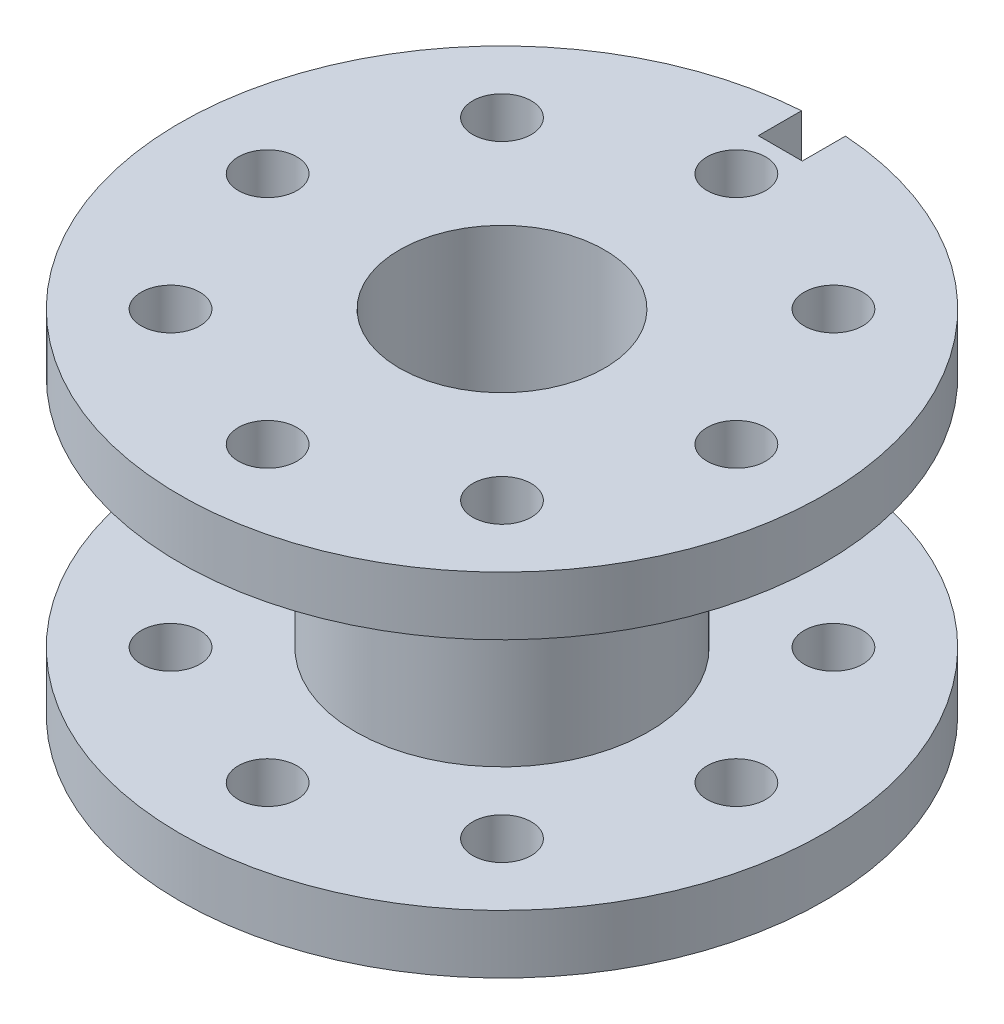
from build123d import *

# Parameters (mm, degrees)
SKETCH1_R           = 11
SKETCH1_R_2         = 1
BOSS_EXTRUDE1_DEPTH = 12
SKETCH2_R           = 3.5
CUT_EXTRUDE1_DEPTH  = 20.646882704
CUT_EXTRUDE2_START  = -8
SKETCH3_R           = 11
SKETCH3_R_2         = 5
CUT_EXTRUDE2_DEPTH  = 8
SKETCH4_W           = 1.5
SKETCH4_H           = 3
CUT_EXTRUDE3_DEPTH  = 4


with BuildPart() as part:
    # Sketch1 → Boss-Extrude1 (new body)
    with BuildSketch(Plane(origin=(0, 0, 0), x_dir=(1, 0, 0), z_dir=(0, 1, 0))):
        Circle(SKETCH1_R)
        with Locations((0, 8)):
            Circle(SKETCH1_R_2, mode=Mode.SUBTRACT)
        with Locations((5.656854249, 5.656854249)):
            Circle(SKETCH1_R_2, mode=Mode.SUBTRACT)
        with Locations((8, 0)):
            Circle(SKETCH1_R_2, mode=Mode.SUBTRACT)
        with Locations((5.656854249, -5.656854249)):
            Circle(SKETCH1_R_2, mode=Mode.SUBTRACT)
        with Locations((0, -8)):
            Circle(SKETCH1_R_2, mode=Mode.SUBTRACT)
        with Locations((-5.656854249, -5.656854249)):
            Circle(SKETCH1_R_2, mode=Mode.SUBTRACT)
        with Locations((-8, 0)):
            Circle(SKETCH1_R_2, mode=Mode.SUBTRACT)
        with Locations((-5.656854249, 5.656854249)):
            Circle(SKETCH1_R_2, mode=Mode.SUBTRACT)
    extrude(amount=BOSS_EXTRUDE1_DEPTH)

    # Sketch2 → Cut-Extrude1 (cut, through all)
    with BuildSketch(Plane(origin=(0, 12, 0), x_dir=(1, 0, 0), z_dir=(0, 1, 0))):
        Circle(SKETCH2_R)
    extrude(amount=-CUT_EXTRUDE1_DEPTH, mode=Mode.SUBTRACT)

    # Sketch3 → Cut-Extrude2 (cut)
    with BuildSketch(Plane(origin=(0, 10, 0), x_dir=(1, 0, 0), z_dir=(0, 1, 0)).offset(CUT_EXTRUDE2_START)):
        Circle(SKETCH3_R)
        Circle(SKETCH3_R_2, mode=Mode.SUBTRACT)
    extrude(amount=CUT_EXTRUDE2_DEPTH, mode=Mode.SUBTRACT)

    # Sketch4 → Cut-Extrude3 (cut)
    with BuildSketch(Plane(origin=(0, 12, 0), x_dir=(1, 0, 0), z_dir=(0, 1, 0))):
        with Locations((0, 11)):
            Rectangle(SKETCH4_W, SKETCH4_H)
    extrude(amount=-CUT_EXTRUDE3_DEPTH, mode=Mode.SUBTRACT)


solid = part.part
